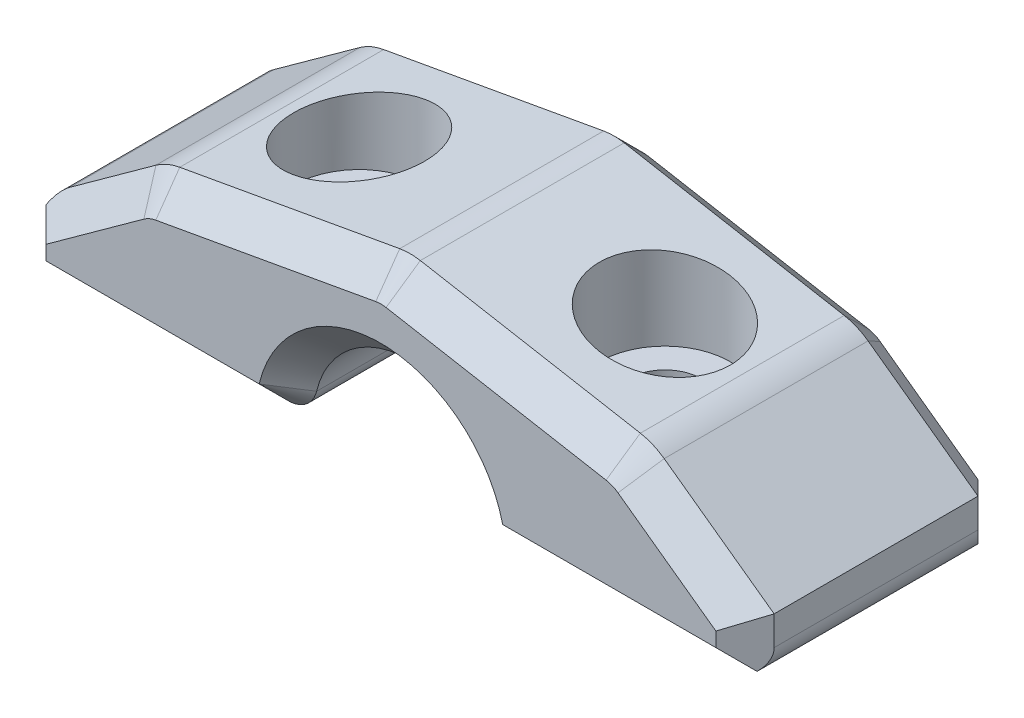
from build123d import *

# Parameters (mm, degrees)
BOSS_EXTRUDE1_DEPTH     = 9
CUT_EXTRUDE1_DEPTH      = 17.718253497
CUT_EXTRUDE1_DEPTH_BACK = 17.718253497
CHAMFER1_SIZE           = 1
FILLET3_R               = 1
SKETCH4_R               = 1.25
CUT_EXTRUDE2_DEPTH      = 17.718253497
CUT_EXTRUDE3_START      = 3
SKETCH5_R               = 2.25
CUT_EXTRUDE3_DEPTH      = 10
FILLET2_R               = 2
CHAMFER2_SIZE           = 1
CHAMFER3_SIZE           = 1


with BuildPart() as part:
    # Sketch1 → Boss-Extrude1 (new body)
    with BuildSketch(Plane.XY):
        with BuildLine():
            Line((-3.3, 0), (-12.5, 0))
            Line((-12.5, 0), (-12.5, 6.5))
            Line((-12.5, 6.5), (12.5, 6.5))
            Line((12.5, 6.5), (12.5, 0))
            Line((12.5, 0), (3.3, 0))
            ThreePointArc((3.3, 0), (0, 3.3), (-3.3, 0))
        make_face()
    extrude(amount=BOSS_EXTRUDE1_DEPTH)

    # Sketch2 → Cut-Extrude1 (cut, two sides: drawn at the far end of the back side and taken through both)
    with BuildSketch(Plane.XY.offset(9).offset(-CUT_EXTRUDE1_DEPTH_BACK)):
        Polygon((-8.355690819, 5), (0, 6.5), (-12.5, 6.5), (-12.5, 2.004439372), align=None)
        Polygon((12.5, 6.5), (0, 6.5), (8.355690819, 5), (12.5, 2.004439372), align=None)
    extrude(amount=CUT_EXTRUDE1_DEPTH + CUT_EXTRUDE1_DEPTH_BACK, mode=Mode.SUBTRACT)

    # Chamfer1
    chamfer1_edges = [part.edges().sort_by_distance(p)[0] for p in [
        (12.5, 1.002219686, 9),
        (-12.5, 1.002219686, 0),
        (-12.5, 1.002219686, 9),
        (12.5, 1.002219686, 0),
    ]]
    chamfer(chamfer1_edges, length=CHAMFER1_SIZE)

    # Fillet3
    fillet3_edges = [part.edges().sort_by_distance(p)[0] for p in [
        (12.5, 0, 4.5),
        (3.3, 0, 4.5),
        (-12.5, 0, 4.5),
        (-3.3, 0, 4.5),
    ]]
    fillet(fillet3_edges, radius=FILLET3_R)

    # Sketch4 → Cut-Extrude2 (cut, through all)
    with BuildSketch(Plane.XZ):
        with Locations(Location((-5.25, 4.5, 0), (0, 0, 31.315725107))):
            Circle(SKETCH4_R)
        with Locations((5.25, 4.5)):
            Circle(SKETCH4_R)
    extrude(amount=-CUT_EXTRUDE2_DEPTH, mode=Mode.SUBTRACT)

    # Sketch5 → Cut-Extrude3 (cut)
    with BuildSketch(Plane(origin=(0, 0, 0), x_dir=(1, 0, 0), z_dir=(0, 1, 0)).offset(CUT_EXTRUDE3_START)):
        with Locations(Location((-5.25, -4.5, 0), (0, 0, 180))):
            Circle(SKETCH5_R)
        with Locations((5.25, -4.5)):
            Circle(SKETCH5_R)
    extrude(amount=CUT_EXTRUDE3_DEPTH, mode=Mode.SUBTRACT)

    # Fillet2
    # the kernel refuses this fillet: 2 mm, written as the material it takes off along each edge
    with BuildSketch(Plane(origin=(8.355690819, 5, -1.139765225), x_dir=(0.8104519016588886, -0.5858051852770605, 0), z_dir=(0, 0, 1))) as fillet2_piece_1:
        with BuildLine():
            CenterArc((FILLET2_R * 0.227953044968, -FILLET2_R), FILLET2_R, 90, 25.682650877)
            Line((-FILLET2_R * 0.20543317424, -FILLET2_R * 0.0987917083155), (0, 0))
            Line((0, 0), (FILLET2_R * 0.227953044968, 0))
        make_face()
    extrude(amount=11.27953045, mode=Mode.SUBTRACT)
    with BuildSketch(Plane(origin=(-8.355690819, 5, 10.139765225), x_dir=(0.9842658682259174, 0.17669380477391092, 0), z_dir=(0, 0, -1))) as fillet2_piece_2:
        with BuildLine():
            CenterArc((FILLET2_R * 0.227953044968, FILLET2_R), FILLET2_R, 244.317349123, 25.682650877)
            Line((-FILLET2_R * 0.20543317424, FILLET2_R * 0.0987917083155), (0, 0))
            Line((0, 0), (FILLET2_R * 0.227953044968, 0))
        make_face()
    extrude(amount=11.27953045, mode=Mode.SUBTRACT)
    with BuildSketch(Plane(origin=(0, 6.5, 9.897591852), x_dir=(0.9842658682259177, -0.17669380477391017, 0), z_dir=(0, 0, -1))) as fillet2_piece_3:
        with BuildLine():
            CenterArc((FILLET2_R * 0.179518370471, FILLET2_R), FILLET2_R, 249.645515661, 20.354484339)
            Line((-FILLET2_R * 0.168308991861, FILLET2_R * 0.062441401291), (0, 0))
            Line((0, 0), (FILLET2_R * 0.179518370471, 0))
        make_face()
    extrude(amount=10.795183705, mode=Mode.SUBTRACT)
    with BuildSketch(Plane(origin=(-12.5, 2.004439372, -1.554843318), x_dir=(0.8104519016588881, 0.5858051852770613, 0), z_dir=(0, 0, 1))) as fillet2_piece_4:
        with BuildLine():
            CenterArc((1.021937327, -2), FILLET2_R, 90, 53.119715667)
            Line((-0.577845108, -0.799709969), (-0.737823352, -0.679680966))
            ThreePointArc((-0.737823352, -0.679680966), (-0.750496173, -0.696888762), (-0.16209038, 0.117161037))
            Line((-0.16209038, 0.117161037), (0, 0.2))
            Line((0, 0.2), (1.021937327, 0.2))
            Line((1.021937327, 0.2), (1.021937327, 0))
        make_face()
    extrude(amount=12.109686635, mode=Mode.SUBTRACT)

    # Chamfer2
    chamfer2_edges = [part.edges().sort_by_distance(p)[0] for p in [
        (7.841052367, 0, 0),
        (3.562652612, 0.214965561, 0),
        (-7.841052367, 0, 0),
        (-3.562652612, 0.214965561, 0),
        (0, 3.3, 0),
    ]]
    chamfer(chamfer2_edges, length=CHAMFER2_SIZE)
    # the kernel refuses this chamfer: 1 mm, written as the material it takes off along each edge
    with BuildSketch(Plane(origin=(8.725180777, 4.732927849, 0), x_dir=(-0.585583702243233, -0.8101454835006636, -0.027495876610586348), z_dir=(0.8104519016588884, -0.5858051852770609, 0)), Plane(origin=(-13.584225368, 1.220747161, 0), x_dir=(0.5855837022432331, -0.8101454835006635, -0.027495876610586348), z_dir=(0.8104519016588883, 0.585805185277061, 0))) as chamfer2_2_piece_1:
        with BuildLine():
            Line((1.028673195, 0), (-0.056547155, -1.027117794))
            Line((-0.056547155, -1.027117794), (-0.076539593, -1.026567876))
            ThreePointArc((-0.076539593, -1.026567876), (-0.034129227, -0.51339783), (-0.019992438, 0.000549918))
            Line((-0.019992438, 0.000549918), (0.000549918, 0.019992438))
            ThreePointArc((0.000549918, 0.019992438), (0.514497665, 0.00585565), (1.029223113, 0.019992438))
            Line((1.029223113, 0.019992438), (1.028673195, 0))
        make_face()
    extrude(amount=5.995475588, mode=Mode.SUBTRACT)
    with BuildSketch(Plane(origin=(7.553570406, 3.112024045, 0), x_dir=(0.1766938047737976, 0.9842658682259378, 0), z_dir=(-0.9842658682259378, 0.1766938047737976, 0))) as chamfer2_2_piece_2:
        with BuildLine():
            Line((0.971715729, 0.028284271), (2.028284271, -1.028284271))
            Line((2.028284271, -1.028284271), (2.048284271, -1.028284271))
            ThreePointArc((2.048284271, -1.028284271), (2.02, -0.514142136), (2.02, 0))
            Line((2.02, 0), (2, 0.02))
            ThreePointArc((2, 0.02), (1.485857864, 0.02), (0.971715729, 0.048284271))
            Line((0.971715729, 0.048284271), (0.971715729, 0.028284271))
        make_face()
    revolve(axis=Axis((7.553570406, 3.112024045, 0), (0, 0, -1)), revolution_arc=25.682650877, mode=Mode.SUBTRACT)
    with BuildSketch(Plane(origin=(0.35338761, 6.436560432, 0), x_dir=(-0.176626999834447, -0.9838937339463534, -0.027495876610586348), z_dir=(0.9842658682259174, -0.17669380477391067, 0)), Plane(origin=(-7.906958016, 5.080555782, 0), x_dir=(0.17662699983444718, -0.9838937339463534, -0.02749587661058635), z_dir=(0.9842658682259174, 0.17669380477391086, 0))) as chamfer2_2_piece_3:
        with BuildLine():
            Line((1.028673195, 0), (-0.056547155, -1.027117794))
            Line((-0.056547155, -1.027117794), (-0.076539593, -1.026567876))
            ThreePointArc((-0.076539593, -1.026567876), (-0.034129227, -0.51339783), (-0.019992438, 0.000549918))
            Line((-0.019992438, 0.000549918), (0.000549918, 0.019992438))
            ThreePointArc((0.000549918, 0.019992438), (0.514497665, 0.00585565), (1.029223113, 0.019992438))
            Line((1.029223113, 0.019992438), (1.028673195, 0))
        make_face()
    extrude(amount=7.674319155, mode=Mode.SUBTRACT)
    with BuildSketch(Plane(origin=(0, 4.468028696, 0), x_dir=(0.1766938047739827, 0.9842658682259047, 0), z_dir=(0.9842658682259047, -0.1766938047739827, 0))) as chamfer2_2_piece_4:
        with BuildLine():
            Line((0.971715729, -0.028284271), (2.028284271, 1.028284271))
            Line((2.028284271, 1.028284271), (2.048284271, 1.028284271))
            ThreePointArc((2.048284271, 1.028284271), (2.02, 0.514142136), (2.02, 0))
            Line((2.02, 0), (2, -0.02))
            ThreePointArc((2, -0.02), (1.485857864, -0.02), (0.971715729, -0.048284271))
            Line((0.971715729, -0.048284271), (0.971715729, -0.028284271))
        make_face()
    revolve(axis=Axis((0, 4.468028696, 0), (0, 0, 1)), revolution_arc=20.354484339, mode=Mode.SUBTRACT)
    with BuildSketch(Plane(origin=(-7.553570406, 3.112024045, 0), x_dir=(-0.17669380477398322, 0.9842658682259045, 0), z_dir=(0.9842658682259045, 0.17669380477398322, 0))) as chamfer2_2_piece_5:
        with BuildLine():
            Line((0.971715729, -0.028284271), (2.028284271, 1.028284271))
            Line((2.028284271, 1.028284271), (2.048284271, 1.028284271))
            ThreePointArc((2.048284271, 1.028284271), (2.02, 0.514142136), (2.02, 0))
            Line((2.02, 0), (2, -0.02))
            ThreePointArc((2, -0.02), (1.485857864, -0.02), (0.971715729, -0.048284271))
            Line((0.971715729, -0.048284271), (0.971715729, -0.028284271))
        make_face()
    revolve(axis=Axis((-7.553570406, 3.112024045, 0), (0, 0, 1)), revolution_arc=25.682650877, mode=Mode.SUBTRACT)

    # Chamfer3
    chamfer3_edges = [part.edges().sort_by_distance(p)[0] for p in [
        (7.841052367, 0, 9),
        (3.562652612, 0.214965561, 9),
        (-7.841052367, 0, 9),
        (-3.562652612, 0.214965561, 9),
        (0, 3.3, 9),
    ]]
    chamfer(chamfer3_edges, length=CHAMFER3_SIZE)
    # the kernel refuses this chamfer: 1 mm, written as the material it takes off along each edge
    with BuildSketch(Plane(origin=(8.725180777, 4.732927849, 9), x_dir=(-0.585583702243233, -0.8101454835006636, 0.027495876610585605), z_dir=(0.8104519016588884, -0.5858051852770609, 0)), Plane(origin=(-13.584225368, 1.220747161, 9), x_dir=(0.5855837022432332, -0.8101454835006637, 0.027495876610585605), z_dir=(0.8104519016588883, 0.585805185277061, 0))) as chamfer3_2_piece_1:
        with BuildLine():
            Line((1.028673195, 0), (-0.056547155, 1.027117794))
            Line((-0.056547155, 1.027117794), (-0.076539593, 1.026567876))
            ThreePointArc((-0.076539593, 1.026567876), (-0.034129227, 0.51339783), (-0.019992438, -0.000549918))
            Line((-0.019992438, -0.000549918), (0.000549918, -0.019992438))
            ThreePointArc((0.000549918, -0.019992438), (0.514497665, -0.00585565), (1.029223113, -0.019992438))
            Line((1.029223113, -0.019992438), (1.028673195, 0))
        make_face()
    extrude(amount=5.995475588, mode=Mode.SUBTRACT)
    with BuildSketch(Plane(origin=(7.553570406, 3.112024045, 9), x_dir=(0.1766938047737976, 0.9842658682259378, 0), z_dir=(-0.9842658682259378, 0.1766938047737976, 0))) as chamfer3_2_piece_2:
        with BuildLine():
            Line((0.971715729, -0.028284271), (2.028284271, 1.028284271))
            Line((2.028284271, 1.028284271), (2.048284271, 1.028284271))
            ThreePointArc((2.048284271, 1.028284271), (2.02, 0.514142136), (2.02, 0))
            Line((2.02, 0), (2, -0.02))
            ThreePointArc((2, -0.02), (1.485857864, -0.02), (0.971715729, -0.048284271))
            Line((0.971715729, -0.048284271), (0.971715729, -0.028284271))
        make_face()
    revolve(axis=Axis((7.553570406, 3.112024045, 9), (0, 0, -1)), revolution_arc=25.682650877, mode=Mode.SUBTRACT)
    with BuildSketch(Plane(origin=(0.35338761, 6.436560432, 9), x_dir=(-0.176626999834447, -0.9838937339463534, 0.027495876610585612), z_dir=(0.9842658682259174, -0.17669380477391067, 0)), Plane(origin=(-7.906958016, 5.080555782, 9), x_dir=(0.17662699983444718, -0.9838937339463534, 0.027495876610585612), z_dir=(0.9842658682259174, 0.17669380477391086, 0))) as chamfer3_2_piece_3:
        with BuildLine():
            Line((1.028673195, 0), (-0.056547155, 1.027117794))
            Line((-0.056547155, 1.027117794), (-0.076539593, 1.026567876))
            ThreePointArc((-0.076539593, 1.026567876), (-0.034129227, 0.51339783), (-0.019992438, -0.000549918))
            Line((-0.019992438, -0.000549918), (0.000549918, -0.019992438))
            ThreePointArc((0.000549918, -0.019992438), (0.514497665, -0.00585565), (1.029223113, -0.019992438))
            Line((1.029223113, -0.019992438), (1.028673195, 0))
        make_face()
    extrude(amount=7.674319155, mode=Mode.SUBTRACT)
    with BuildSketch(Plane(origin=(0, 4.468028696, 9), x_dir=(0.1766938047739827, 0.9842658682259047, 0), z_dir=(0.9842658682259047, -0.1766938047739827, 0))) as chamfer3_2_piece_4:
        with BuildLine():
            Line((0.971715729, 0.028284271), (2.028284271, -1.028284271))
            Line((2.028284271, -1.028284271), (2.048284271, -1.028284271))
            ThreePointArc((2.048284271, -1.028284271), (2.02, -0.514142136), (2.02, 0))
            Line((2.02, 0), (2, 0.02))
            ThreePointArc((2, 0.02), (1.485857864, 0.02), (0.971715729, 0.048284271))
            Line((0.971715729, 0.048284271), (0.971715729, 0.028284271))
        make_face()
    revolve(axis=Axis((0, 4.468028696, 9), (0, 0, 1)), revolution_arc=20.354484339, mode=Mode.SUBTRACT)
    with BuildSketch(Plane(origin=(-7.553570406, 3.112024045, 9), x_dir=(-0.17669380477398322, 0.9842658682259045, 0), z_dir=(0.9842658682259045, 0.17669380477398322, 0))) as chamfer3_2_piece_5:
        with BuildLine():
            Line((0.971715729, 0.028284271), (2.028284271, -1.028284271))
            Line((2.028284271, -1.028284271), (2.048284271, -1.028284271))
            ThreePointArc((2.048284271, -1.028284271), (2.02, -0.514142136), (2.02, 0))
            Line((2.02, 0), (2, 0.02))
            ThreePointArc((2, 0.02), (1.485857864, 0.02), (0.971715729, 0.048284271))
            Line((0.971715729, 0.048284271), (0.971715729, 0.028284271))
        make_face()
    revolve(axis=Axis((-7.553570406, 3.112024045, 9), (0, 0, 1)), revolution_arc=25.682650877, mode=Mode.SUBTRACT)


solid = part.part
